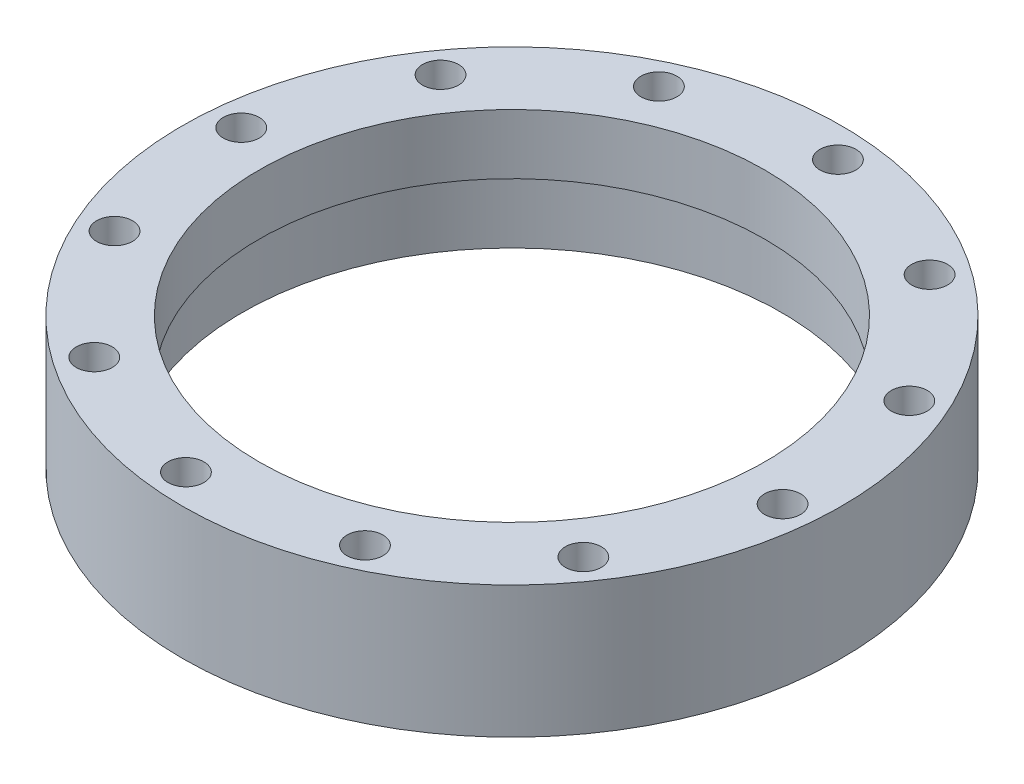
from build123d import *

# Parameters (mm, degrees)
SKETCH1_R           = 27.5
SKETCH1_R_2         = 22.5
SKETCH1_R_3         = 1.5
BOSS_EXTRUDE1_DEPTH = 11
BOSS_EXTRUDE2_START = -5
SKETCH2_R           = 22.5
SKETCH2_R_2         = 21.1
BOSS_EXTRUDE2_DEPTH = 5


with BuildPart() as part:
    # Sketch1 → Boss-Extrude1 (new body)
    with BuildSketch(Plane(origin=(0, 0, 0), x_dir=(1, 0, 0), z_dir=(0, 1, 0))):
        Circle(SKETCH1_R)
        Circle(SKETCH1_R_2, mode=Mode.SUBTRACT)
        with Locations((2.308641256, 24.893175281)):
            Circle(SKETCH1_R_3, mode=Mode.SUBTRACT)
        with Locations((14.445929616, 20.403801546)):
            Circle(SKETCH1_R_3, mode=Mode.SUBTRACT)
        with Locations((22.712442802, 10.447245665)):
            Circle(SKETCH1_R_3, mode=Mode.SUBTRACT)
        with Locations((24.893175281, -2.308641256)):
            Circle(SKETCH1_R_3, mode=Mode.SUBTRACT)
        with Locations((20.403801546, -14.445929616)):
            Circle(SKETCH1_R_3, mode=Mode.SUBTRACT)
        with Locations((10.447245665, -22.712442802)):
            Circle(SKETCH1_R_3, mode=Mode.SUBTRACT)
        with Locations((-2.308641256, -24.893175281)):
            Circle(SKETCH1_R_3, mode=Mode.SUBTRACT)
        with Locations((-14.445929616, -20.403801546)):
            Circle(SKETCH1_R_3, mode=Mode.SUBTRACT)
        with Locations((-22.712442802, -10.447245665)):
            Circle(SKETCH1_R_3, mode=Mode.SUBTRACT)
        with Locations((-24.893175281, 2.308641256)):
            Circle(SKETCH1_R_3, mode=Mode.SUBTRACT)
        with Locations((-20.403801546, 14.445929616)):
            Circle(SKETCH1_R_3, mode=Mode.SUBTRACT)
        with Locations((-10.447245665, 22.712442802)):
            Circle(SKETCH1_R_3, mode=Mode.SUBTRACT)
    extrude(amount=BOSS_EXTRUDE1_DEPTH)

    # Sketch2 → Boss-Extrude2 (add)
    with BuildSketch(Plane(origin=(0, 11, 0), x_dir=(1, 0, 0), z_dir=(0, 1, 0)).offset(BOSS_EXTRUDE2_START)):
        Circle(SKETCH2_R)
        Circle(SKETCH2_R_2, mode=Mode.SUBTRACT)
    extrude(amount=BOSS_EXTRUDE2_DEPTH)


solid = part.part
